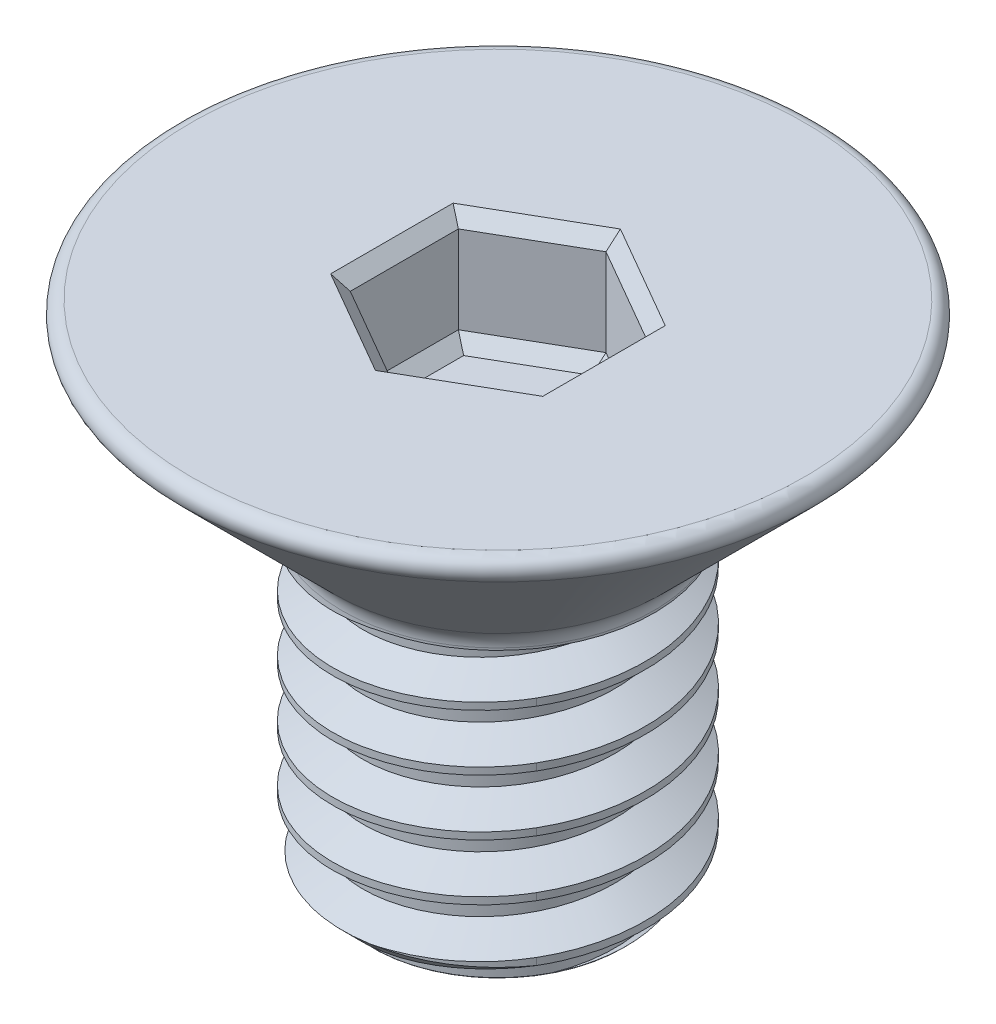
from build123d import *

# Parameters (mm, degrees)
SKETCH1_R           = 1.25
BOSS_EXTRUDE1_DEPTH = 2.45
THREAD1_PITCH       = 0.45
SKETCH5_R           = 1.25
BOSS_EXTRUDE2_DEPTH = 0.1
SKETCH6_R           = 1.25
BOSS_EXTRUDE3_DEPTH = 1.45
BOSS_EXTRUDE3_DRAFT = -45
FILLET1_R           = 0.2
FILLET2_R           = 0.1
CUT_EXTRUDE1_DEPTH  = 0.8
CHAMFER1_SIZE       = 0.1
CUT_EXTRUDE2_DEPTH  = 0.1
CUT_EXTRUDE2_DRAFT  = -45


with BuildPart() as part:
    # Sketch1 → Boss-Extrude1 (new body)
    with BuildSketch(Plane(origin=(0, 0, 0), x_dir=(1, 0, 0), z_dir=(0, 1, 0))):
        with Locations(Location((0, 0, 0), (0, 0, 270))):
            Circle(SKETCH1_R)
    extrude(amount=BOSS_EXTRUDE1_DEPTH)

    # Thread1: the profile of Thread Profile1 profile screwed along a right-hand helix of 7.666667 turns, 6 arcs to a turn; built about Z, then put on its axis
    thread1_z = Axis((0, 0, 0), (0, 0, 1))
    thread1_corners = [(1.2503, 0, -0.000173205), (1.2503, 0, 0.393923204), (1.006430356, 0, 0.253124999), (1.006430356, 0, 0.140624999)]
    with BuildLine(mode=Mode.PRIVATE) as thread1_profile:
        Line(thread1_corners[0], thread1_corners[1])
        Line(thread1_corners[1], thread1_corners[2])
        Line(thread1_corners[2], thread1_corners[3])
        Line(thread1_corners[3], thread1_corners[0])
    thread1_cap = Face(thread1_profile.wire())
    thread1_turn_angles = [0, 30, 60, 90, 120, 150, 180, 210, 240, 270, 300, 330, 360]
    thread1_turn_weights = [1, 0.8660254037844387, 1, 0.8660254037844387, 1, 0.8660254037844387, 1, 0.8660254037844387, 1, 0.8660254037844387, 1, 0.8660254037844387, 1]
    thread1_turn_rails = [Edge.make_bspline([Vector(p[0], p[1], 0).rotate(thread1_z, thread1_turn_angles[k]) / thread1_turn_weights[k] + Vector(0, 0, p[2] + THREAD1_PITCH * thread1_turn_angles[k] / 360) for k in range(13)], [0, 0, 0, 1, 1, 2, 2, 3, 3, 4, 4, 5, 5, 6, 6, 6], 2, thread1_turn_weights) for p in thread1_corners]
    thread1_turn_sides = [Face.make_surface_from_curves(thread1_turn_rails[p[0]], thread1_turn_rails[p[1]]) for p in [(0, 1), (1, 2), (2, 3), (3, 0)]]
    thread1_last_angles = [2520, 2550, 2580, 2610, 2640, 2670, 2700, 2730, 2760]
    thread1_last_weights = [1, 0.8660254037844387, 1, 0.8660254037844387, 1, 0.8660254037844387, 1, 0.8660254037844367, 1]
    thread1_last_rails = [Edge.make_bspline([Vector(p[0], p[1], 0).rotate(thread1_z, thread1_last_angles[k]) / thread1_last_weights[k] + Vector(0, 0, p[2] + THREAD1_PITCH * thread1_last_angles[k] / 360) for k in range(9)], [0, 0, 0, 1, 1, 2, 2, 3, 3, 4, 4, 4], 2, thread1_last_weights) for p in thread1_corners]
    thread1_last_sides = [Face.make_surface_from_curves(thread1_last_rails[p[0]], thread1_last_rails[p[1]]) for p in [(0, 1), (1, 2), (2, 3), (3, 0)]]
    thread1 = Plane(origin=(0, -1, 0), x_dir=(1, 0, 0), z_dir=(0, 1, 0)) * Solid(Shell([*[p.moved(Location((0, 0, THREAD1_PITCH * i))) for i in range(7) for p in thread1_turn_sides], *thread1_last_sides, thread1_cap, thread1_cap.rotate(thread1_z, 2760).moved(Location((0, 0, THREAD1_PITCH * 2760 / 360)))]))
    add(thread1, mode=Mode.SUBTRACT)

    # Sketch5 → Boss-Extrude2 (add)
    with BuildSketch(Plane(origin=(0, 2.45, 0), x_dir=(1, 0, 0), z_dir=(0, 1, 0))):
        with Locations(Location((0, 0, 0), (0, 0, 325.133649001))):
            Circle(SKETCH5_R)
    extrude(amount=BOSS_EXTRUDE2_DEPTH)


with BuildPart() as boss_extrude3_tool:
    # Sketch6 → Boss-Extrude3 (with draft: the straight prism first)
    with BuildSketch(Plane(origin=(0, 2.55, 0), x_dir=(1, 0, 0), z_dir=(0, 1, 0))):
        with Locations(Location((0, 0, 0), (0, 0, 325.133649001))):
            Circle(SKETCH6_R)
    extrude(amount=BOSS_EXTRUDE3_DEPTH)
    # Boss-Extrude3: the draft: its side faces are tilted about the plane it starts from
    boss_extrude3_sides = [boss_extrude3_tool.faces().sort_by_distance(p)[0] for p in [
        (-1.025609684, 3.275, -0.714580139),
    ]]
    draft(boss_extrude3_sides, Plane(origin=(0, 2.55, 0), x_dir=(1, 0, 0), z_dir=(0, 1, 0)), BOSS_EXTRUDE3_DRAFT)


with BuildPart() as part_1:
    add(part.part)

    # Boss-Extrude3: add boss_extrude3_tool
    add(boss_extrude3_tool.part)

    # Fillet1
    fillet1_edges = [part_1.edges().sort_by_distance(p)[0] for p in [
        (-1.025609684, 2.55, -0.714580139),
    ]]
    fillet(fillet1_edges, radius=FILLET1_R)

    # Fillet2
    fillet2_edges = [part_1.edges().sort_by_distance(p)[0] for p in [
        (-2.215316919, 4, -1.5434931),
    ]]
    fillet(fillet2_edges, radius=FILLET2_R)

    # Sketch7 → Cut-Revolve1 (revolve, cut)
    with BuildSketch(Plane.XY, mode=Mode.PRIVATE) as cut_revolve1_sk:
        Polygon((1.26, 0), (1.26, 0.26), (1, 0), align=None)
    revolve(cut_revolve1_sk.sketch.rotate(Axis((0, 0, 0), (0, 1, 0)), 325.133649001), axis=Axis((0, 0, 0), (0, 1, 0)), mode=Mode.SUBTRACT)

    # Sketch8 → Cut-Extrude1 (cut)
    with BuildSketch(Plane(origin=(0, 4, 0), x_dir=(1, 0, 0), z_dir=(0, 1, 0))):
        Polygon((0, 0.866025404), (-0.75, 0.433012702), (-0.75, -0.433012702), (0, -0.866025404), (0.75, -0.433012702), (0.75, 0.433012702), align=None)
    extrude(amount=-CUT_EXTRUDE1_DEPTH, mode=Mode.SUBTRACT)

    # Chamfer1
    chamfer1_edges = [part_1.edges().sort_by_distance(p)[0] for p in [
        (0.375, 4, -0.649519053),
        (-0.375, 4, -0.649519053),
        (-0.75, 4, 0),
        (-0.375, 4, 0.649519053),
        (0.375, 4, 0.649519053),
        (0.75, 4, 0),
    ]]
    chamfer(chamfer1_edges, length=CHAMFER1_SIZE)


with BuildPart() as cut_extrude2_tool:
    # Sketch9 → Cut-Extrude2 (with draft: the straight prism first)
    with BuildSketch(Plane(origin=(0, 3.2, 0), x_dir=(1, 0, 0), z_dir=(0, 1, 0))):
        Polygon((0, 0.866025404), (-0.75, 0.433012702), (-0.75, -0.433012702), (0, -0.866025404), (0.75, -0.433012702), (0.75, 0.433012702), align=None)
    extrude(amount=-CUT_EXTRUDE2_DEPTH)
    # Cut-Extrude2: the draft: its side faces are tilted about the plane it starts from
    cut_extrude2_sides = [cut_extrude2_tool.faces().sort_by_distance(p)[0] for p in [
        (-0.375, 3.15, -0.649519053),
        (-0.75, 3.15, 0),
        (-0.375, 3.15, 0.649519053),
        (0.375, 3.15, 0.649519053),
        (0.75, 3.15, 0),
        (0.375, 3.15, -0.649519053),
    ]]
    draft(cut_extrude2_sides, Plane(origin=(0, 3.2, 0), x_dir=(1, 0, 0), z_dir=(0, 1, 0)), CUT_EXTRUDE2_DRAFT)


with BuildPart() as part_2:
    add(part_1.part)

    # Cut-Extrude2: cut by cut_extrude2_tool
    add(cut_extrude2_tool.part, mode=Mode.SUBTRACT)


solid = part_2.part
